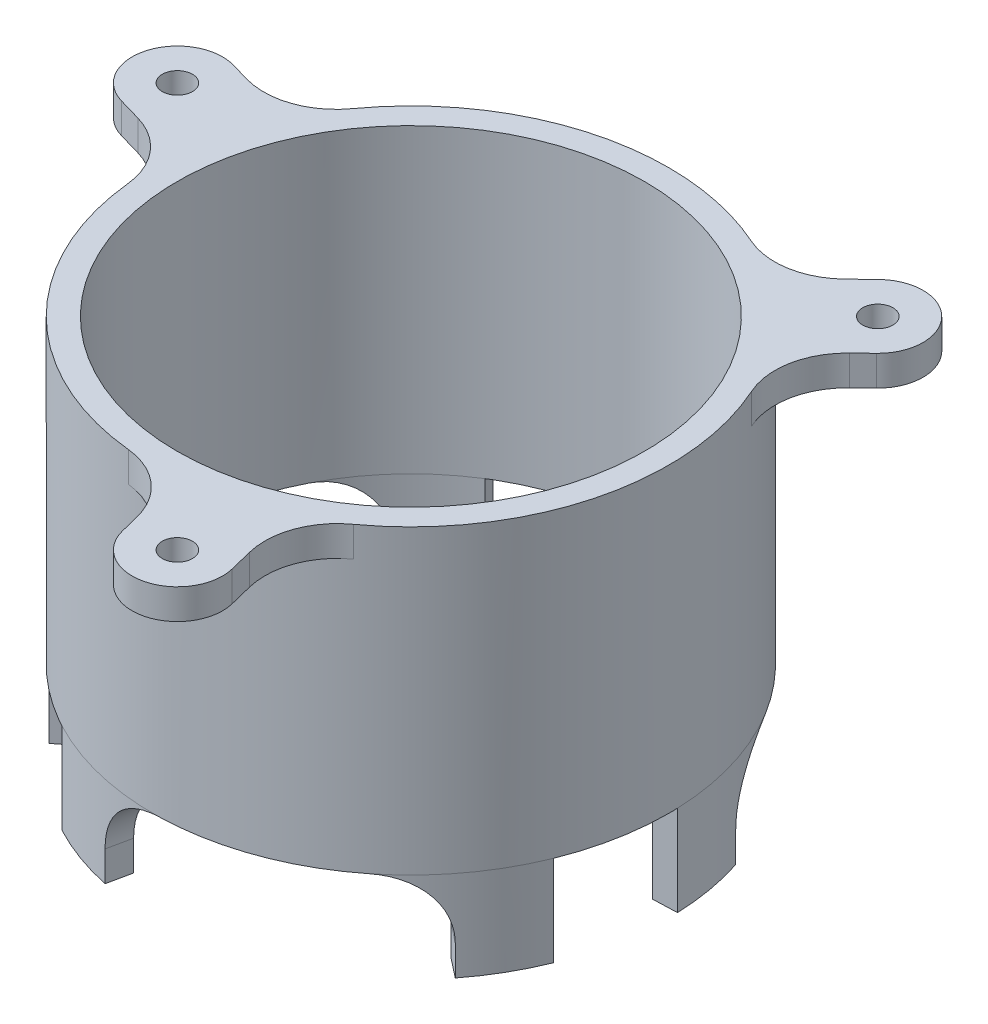
from build123d import *
from build123d.topology import SkipClean

# Parameters (mm, degrees)
SKETCH1_R           = 42.74999999999999
SKETCH1_R_2         = 38.75
BOSS_EXTRUDE1_DEPTH = 50
BOSS_EXTRUDE3_DEPTH = 15
FILLET11_R          = 10
BOSS_EXTRUDE4_START = -5
SKETCH3_R           = 2.5000000000000027
SKETCH3_R_2         = 2.499999999995902
SKETCH3_R_3         = 2.499999999998028
BOSS_EXTRUDE4_DEPTH = 5
FILLET12_R          = 12
CUT_EXTRUDE1_DEPTH  = 99.95736932696003


with BuildPart() as part:
    # Sketch1 → Boss-Extrude1 (new body)
    with BuildSketch(Plane(origin=(0, 0, 0), x_dir=(1, 0, 0), z_dir=(0, 1, 0))):
        with Locations(Location((0, 0, 0), (0, 0, 270))):
            Circle(SKETCH1_R)
        with Locations(Location((0, 0, 0), (0, 0, 270))):
            Circle(SKETCH1_R_2, mode=Mode.SUBTRACT)
    extrude(amount=BOSS_EXTRUDE1_DEPTH)

    # Sketch2 → Boss-Extrude3 (add)
    with BuildSketch(Plane.XZ):
        with BuildLine():
            Line((38.75, 0), (42.74999999999999, 0))
            ThreePointArc((42.74999999999999, 0), (42.22367645063639, -6.68757448683748), (40.657665385647135, -13.210478620729493))
            Line((40.657665385647135, -13.210478620729493), (36.853439320466514, -11.974410643229694))
            ThreePointArc((36.853439320466514, -11.974410643229694), (38.272923088255865, -6.061836626676557), (38.75, 0))
        make_face()
        with BuildLine():
            Line((30.53541703259137, 23.856881746065003), (33.68746022219302, 26.319527423154156))
            ThreePointArc((33.68746022219302, 26.319527423154156), (37.3899927357603, 20.7256109377942), (40.17185953859756, 14.621361127172362))
            Line((40.17185953859756, 14.621361127172362), (36.41308905545394, 13.253280553869686))
            ThreePointArc((36.41308905545394, 13.253280553869686), (33.891513838231084, 18.78637258123708), (30.53541703259137, 23.856881746065003))
        make_face()
        with BuildLine():
            Line((-7.423459595259061, -42.10053144127372), (-6.728866884591348, -38.161300429224895))
            ThreePointArc((-6.728866884591348, -38.161300429224895), (-0.6762810188026127, -38.74409824724033), (5.392957130880042, -38.3728877384105))
            Line((5.392957130880042, -38.3728877384105), (5.949649252958357, -42.333960052975826))
            ThreePointArc((5.949649252958357, -42.333960052975826), (-0.7460907867955708, -42.74348902538298), (-7.423459595259061, -42.10053144127372))
        make_face()
        with BuildLine():
            Line((-31.769442774524343, -28.605331772174747), (-28.796863472614763, -25.92880934673931))
            ThreePointArc((-28.796863472614763, -25.92880934673931), (-24.386166056418613, -30.114405358181113), (-19.374999999997826, -33.558484396648836))
            Line((-19.374999999997826, -33.558484396648836), (-21.374999999997822, -37.022586011786586))
            ThreePointArc((-21.374999999997822, -37.022586011786586), (-26.90344762061796, -33.22298920400898), (-31.769442774524343, -28.605331772174747))
        make_face()
        with BuildLine():
            Line((-32.748399943336835, 27.479170314096717), (-29.68422217086093, 24.908019875350572))
            ThreePointArc((-29.68422217086093, 24.908019875350572), (-33.21523281942682, 19.95772566599861), (-35.92837416346974, 14.516005992340855))
            Line((-35.92837416346974, 14.516005992340855), (-39.63710947514971, 16.01443262981703))
            ThreePointArc((-39.63710947514971, 16.01443262981703), (-36.64390194896306, 22.017878087584137), (-32.748399943336835, 27.479170314096717))
        make_face()
        with BuildLine():
            Line((-8.888222611121137, 41.8158103928996), (-8.056575847850104, 37.90321998996437))
            ThreePointArc((-8.056575847850104, 37.90321998996437), (-13.886757031835588, 36.17624198485303), (-19.37500000000052, 33.5584843966442))
            Line((-19.37500000000052, 33.5584843966442), (-21.37500000000052, 37.02258601178195))
            ThreePointArc((-21.37500000000052, 37.02258601178195), (-15.320228830016775, 39.91056369084182), (-8.888222611121137, 41.8158103928996))
        make_face()
    extrude(amount=BOSS_EXTRUDE3_DEPTH)

    # Fillet11
    # the kernel refuses this fillet: 10 mm, written as the material it adds along each edge
    with BuildSketch(Plane(origin=(10.835147097581084, 0, 8.465346264257812), x_dir=(-0.6156614192722877, 0, 0.7880107974004115), z_dir=(0.7880107974004116, 0, 0.6156614192722877))) as fillet11_piece_1_section:
        with BuildLine():
            CenterArc((FILLET11_R, FILLET11_R), FILLET11_R, 180, 90)
            Line((-2.49e-15, FILLET11_R), (0, 0))
            Line((0, 0), (FILLET11_R, 0))
        make_face()
    fillet11_piece_1 = extrude(amount=54, mode=Mode.PRIVATE)
    fillet11_piece_1 = fillet11_piece_1 & Plane(origin=(4.59061190483e-06, -2.230126202783113, 2.54461775206e-06), x_dir=(0.7880107536067299, 0, 0.6156614753256483), z_dir=(0, 1, 0)) * Cylinder(42.749994815925334, 148, mode=Mode.PRIVATE)
    fillet11_piece_1 = fillet11_piece_1 - Plane(origin=(4.59061572045e-06, -2.230126202783113, 2.54461984817e-06), x_dir=(0.9396926280330065, 0, 0.34202012341443), z_dir=(0, 1, 0)) * Cylinder(38.74999481592104, 148, mode=Mode.PRIVATE)
    add(fillet11_piece_1)
    with BuildSketch(Plane(origin=(64.43407829302596, 0, -20.935903480103214), x_dir=(-0.3090169943749489, 0, -0.9510565162951531), z_dir=(-0.9510565162951531, 0, 0.3090169943749489))) as fillet11_piece_2_section:
        with BuildLine():
            CenterArc((FILLET11_R, FILLET11_R), FILLET11_R, 180, 90)
            Line((0, FILLET11_R), (0, 0))
            Line((0, 0), (FILLET11_R, 0))
        make_face()
    fillet11_piece_2 = extrude(amount=54, mode=Mode.PRIVATE)
    fillet11_piece_2 = fillet11_piece_2 & Plane(origin=(5.18407557237e-06, -2.2301270287975066, -8.21077077e-07), x_dir=(0.9999999999999999, 0, 1.920648366230405e-08), z_dir=(0, 1, 0)) * Cylinder(42.749994815924424, 148, mode=Mode.PRIVATE)
    fillet11_piece_2 = fillet11_piece_2 - Plane(origin=(5.18407759387e-06, -2.2301270287975066, -8.2107737676e-07), x_dir=(0.951056492044892, 0, -0.3090170690095685), z_dir=(0, 1, 0)) * Cylinder(38.74999481592241, 148, mode=Mode.PRIVATE)
    add(fillet11_piece_2)
    with BuildSketch(Plane(origin=(1.9136313678905688, 0, -13.616185772377186), x_dir=(0.9902680786413326, 0, 0.13917303051957894), z_dir=(0.13917303051957894, 0, -0.9902680786413326))) as fillet11_piece_3_section:
        with BuildLine():
            CenterArc((FILLET11_R, FILLET11_R), FILLET11_R, 180, 90)
            Line((-1.7e-15, FILLET11_R), (0, 0))
            Line((0, 0), (FILLET11_R, 0))
        make_face()
    fillet11_piece_3 = extrude(amount=53.99999999999999, mode=Mode.PRIVATE)
    fillet11_piece_3 = fillet11_piece_3 & Plane(origin=(-9.160021364e-08, -2.2301268177813673, -5.24789779632e-06), x_dir=(0.13917310096005606, 0, -0.9902680687415717), z_dir=(0, 1, 0)) * Cylinder(42.74999481592479, 148, mode=Mode.PRIVATE)
    fillet11_piece_3 = fillet11_piece_3 - Plane(origin=(-9.160024539e-08, -2.2301268177813673, -5.24790106127e-06), x_dir=(-0.1736481985341157, 0, -0.98480774933276), z_dir=(0, 1, 0)) * Cylinder(38.74999481592157, 148, mode=Mode.PRIVATE)
    add(fillet11_piece_3)
    with BuildSketch(Plane(origin=(-50.348063411459194, 0, -45.333596931146204), x_dir=(-0.6691306063588583, 0, 0.7431448254773941), z_dir=(0.7431448254773941, 0, 0.6691306063588583))) as fillet11_piece_4_section:
        with BuildLine():
            CenterArc((FILLET11_R, FILLET11_R), FILLET11_R, 180, 90)
            Line((0, FILLET11_R), (0, 0))
            Line((0, 0), (FILLET11_R, 0))
        make_face()
    fillet11_piece_4 = extrude(amount=54, mode=Mode.PRIVATE)
    fillet11_piece_4 = fillet11_piece_4 & Plane(origin=(-3.30310971641e-06, -2.2301270903644643, -4.07900507859e-06), x_dir=(-0.4999999833666949, 0, -0.8660254133876817), z_dir=(0, 1, 0)) * Cylinder(42.74999481592363, 148, mode=Mode.PRIVATE)
    fillet11_piece_4 = fillet11_piece_4 - Plane(origin=(-3.30311013208e-06, -2.2301270903644643, -4.07900559019e-06), x_dir=(-0.7431448779877398, 0, -0.6691305480402069), z_dir=(0, 1, 0)) * Cylinder(38.74999481592298, 148, mode=Mode.PRIVATE)
    add(fillet11_piece_4)
    with BuildSketch(Plane(origin=(-12.748778465469993, 0, 5.150839508114776), x_dir=(-0.37460665936904325, 0, -0.92718382791999), z_dir=(-0.9271838279199901, 0, 0.37460665936904325))) as fillet11_piece_5_section:
        with BuildLine():
            CenterArc((FILLET11_R, FILLET11_R), FILLET11_R, 180, 90)
            Line((-7e-16, FILLET11_R), (0, 0))
            Line((0, 0), (FILLET11_R, 0))
        make_face()
    fillet11_piece_5 = extrude(amount=54.000000000000014, mode=Mode.PRIVATE)
    fillet11_piece_5 = fillet11_piece_5 & Plane(origin=(-4.49901083854e-06, -2.230126003773029, 2.70327532093e-06), x_dir=(-0.9271838545667841, 0, 0.37460659341592023), z_dir=(0, 1, 0)) * Cylinder(42.74999481592445, 149, mode=Mode.PRIVATE)
    fillet11_piece_5 = fillet11_piece_5 - Plane(origin=(-4.49901406974e-06, -2.230126003773029, 2.70327729979e-06), x_dir=(-0.7660444294988882, 0, 0.64278762591833), z_dir=(0, 1, 0)) * Cylinder(38.749994815920715, 149, mode=Mode.PRIVATE)
    add(fillet11_piece_5)
    with BuildSketch(Plane(origin=(-14.08601488156509, 0, 66.26950041124476), x_dir=(0.9781476007338059, 0, 0.20791169081775793), z_dir=(0.20791169081775795, 0, -0.9781476007338059))) as fillet11_piece_6_section:
        with BuildLine():
            CenterArc((FILLET11_R, FILLET11_R), FILLET11_R, 180, 90)
            Line((0, FILLET11_R), (0, 0))
            Line((0, 0), (FILLET11_R, 0))
        make_face()
    fillet11_piece_6 = extrude(amount=54.00000000000003, mode=Mode.PRIVATE)
    fillet11_piece_6 = fillet11_piece_6 & Plane(origin=(-1.88096511966e-06, -2.2301273000285007, 4.90007795761e-06), x_dir=(-0.5000000166333063, 0, 0.8660253941811946), z_dir=(0, 1, 0)) * Cylinder(42.74999481592328, 149, mode=Mode.PRIVATE)
    fillet11_piece_6 = fillet11_piece_6 - Plane(origin=(-1.88096534792e-06, -2.2301273000285007, 4.90007855092e-06), x_dir=(-0.20791161405715206, 0, 0.9781476170497733), z_dir=(0, 1, 0)) * Cylinder(38.74999481592266, 149, mode=Mode.PRIVATE)
    add(fillet11_piece_6)

    # Sketch3 → Boss-Extrude4 (add)
    # profile 1 of 3: a face of its own
    with SkipClean():  # the faces are left unmerged after this step: merging them gives an invalid solid
        with BuildSketch(Plane(origin=(0, 50, 0), x_dir=(1, 0, 0), z_dir=(0, 1, 0)).offset(BOSS_EXTRUDE4_START)):
            with BuildLine():
                Line((33.511637227041675, 44.116356899248466), (21.30894025148576, 32.364974360543066))
                ThreePointArc((21.30894025148576, 32.364974360543066), (27.172199137767333, 27.626691695125434), (32.007081006023014, 21.842830985792126))
                Line((32.007081006023014, 21.842830985792126), (43.91655531288513, 33.311835640678616))
                ThreePointArc((43.91655531288513, 33.311835640678616), (44.11635689924832, 43.91655531288527), (33.511637227041675, 44.116356899248466))
            make_face()
            with Locations(Location((38.7140962699634, 38.71409626996354, 0), (0, 0, 270))):
                Circle(SKETCH3_R, mode=Mode.SUBTRACT)
        # profile 2 of 3: a face of its own
        with BuildSketch(Plane(origin=(0, 50, 0), x_dir=(1, 0, 0), z_dir=(0, 1, 0)).offset(BOSS_EXTRUDE4_START)):
            with BuildLine():
                Line((21.450067183648166, -51.08010761065472), (17.374419863318376, -34.636570765787056))
                ThreePointArc((17.374419863318376, -34.636570765787056), (10.33931726161448, -37.345160577562936), (2.912906021253314, -38.64036074510248))
                Line((2.912906021253314, -38.64036074510248), (6.890618255075937, -54.68877036800639))
                ThreePointArc((6.890618255075937, -54.68877036800639), (15.97467409803788, -60.16416345361666), (21.450067183648166, -51.08010761065472))
            make_face()
            with Locations(Location((14.170342719362047, -52.88443898933055, 0), (0, 0, 270))):
                Circle(SKETCH3_R_2, mode=Mode.SUBTRACT)
        # profile 3 of 3: a face of its own
        with BuildSketch(Plane(origin=(0, 50, 0), x_dir=(1, 0, 0), z_dir=(0, 1, 0)).offset(BOSS_EXTRUDE4_START)):
            with BuildLine():
                Line((-54.96170441069497, 6.963750711401009), (-38.68336011480927, 2.2715964052387614))
                ThreePointArc((-38.68336011480927, 2.2715964052387614), (-37.51151639938695, 9.718468882432287), (-34.919987027281465, 16.797529759305117))
                Line((-34.919987027281465, 16.797529759305117), (-50.8071735679662, 21.37693472732252))
                ThreePointArc((-50.8071735679662, 21.37693472732252), (-60.09103099729134, 16.247608140726154), (-54.96170441069497, 6.963750711401009))
            make_face()
            with Locations(Location((-52.88443898933059, 14.170342719361772, 0), (0, 0, 270))):
                Circle(SKETCH3_R_3, mode=Mode.SUBTRACT)
        extrude(amount=BOSS_EXTRUDE4_DEPTH)

    # Fillet12
    # the kernel refuses this fillet: 12 mm, written as the material it adds along each edge
    with BuildSketch(Plane(origin=(34.92538168322465, 50, -24.653198865077854), x_dir=(0.4956414180531426, 0, 0.868527250413175), z_dir=(0, -1, 0))) as fillet12_piece_1:
        with BuildLine():
            CenterArc((9.354319503247144, -11.944643415577572), FILLET12_R, 95.50552505302721, 70.28590162466685)
            Line((-2.2785840931773462, -8.999214089266344), (0, 0))
            ThreePointArc((0, 0), (4.101509320654527, -0.1972078320049116), (8.203018641309042, -2.9e-16))
        make_face()
    extrude(amount=5)
    with BuildSketch(Plane(origin=(24.255614002642524, 50, -35.202665941016626), x_dir=(-0.871971609840304, 0, -0.48955644376568963), z_dir=(0, -1, 0))) as fillet12_piece_2:
        with BuildLine():
            CenterArc((8.932402267564173, 11.949534715437375), FILLET12_R, 196.7679395306473, 67.9755723410264)
            Line((-2.5573706744403597, 8.487581835749301), (0, 0))
            ThreePointArc((0, 0), (3.916514840393532, 0.17978257625434443), (7.833029680787052, 1.1e-16))
        make_face()
    extrude(amount=5)
    with BuildSketch(Plane(origin=(3.887605660092766, 50, 42.57286720707937), x_dir=(-0.9999873717634292, 0, -0.005025566004865019), z_dir=(0, -1, 0))) as fillet12_piece_3:
        with BuildLine():
            CenterArc((9.354319503246753, -11.944643415577572), FILLET12_R, 95.50552505302706, 70.28590162466459)
            Line((-2.2785840931776087, -8.999214089265854), (0, 0))
            ThreePointArc((0, 0), (4.101509320654338, -0.197207832004895), (8.203018641308686, 0))
        make_face()
    extrude(amount=5)
    with BuildSketch(Plane(origin=(18.358595984534514, 50, 38.60731088118716), x_dir=(0.8599541218076301, 0, -0.5103713436176327), z_dir=(0, -1, 0))) as fillet12_piece_4:
        with BuildLine():
            CenterArc((8.932402267564584, 11.949534715437368), FILLET12_R, 196.7679395306447, 67.97557234102874)
            Line((-2.5573706744401097, 8.487581835749824), (0, 0))
            ThreePointArc((0, 0), (3.9165148403936985, 0.17978257625437336), (7.833029680787395, 4.4e-16))
        make_face()
    extrude(amount=5)
    with BuildSketch(Plane(origin=(-38.81298734332038, 50, -17.91966834199929), x_dir=(0.5043459537102459, 0, -0.8635016844083758), z_dir=(0, -1, 0))) as fillet12_piece_5:
        with BuildLine():
            CenterArc((9.354319503247599, -11.944643415577568), FILLET12_R, 95.50552505302745, 70.28590162466934)
            Line((-2.2785840931770296, -8.999214089266896), (0, 0))
            ThreePointArc((0, 0), (4.101509320654717, -0.19720783200493475), (8.203018641309445, 4e-17))
        make_face()
    extrude(amount=5)
    with BuildSketch(Plane(origin=(-42.61420998717906, 50, -3.404644940167401), x_dir=(0.012017488032744224, 0, 0.9999277873833604), z_dir=(0, -1, 0))) as fillet12_piece_6:
        with BuildLine():
            CenterArc((8.932402267563731, 11.949534715437377), FILLET12_R, 196.76793953064976, 67.97557234102419)
            Line((-2.5573706744406537, 8.487581835748815), (0, 0))
            ThreePointArc((0, 0), (3.916514840393324, 0.17978257625433922), (7.8330296807866535, 0))
        make_face()
    extrude(amount=5)

    # Sketch4 → Cut-Extrude1 (cut, through all)
    with SkipClean():  # the faces are left unmerged after this step: merging them gives an invalid solid
        with BuildSketch(Plane(origin=(0, 0, 0), x_dir=(1, 0, 0), z_dir=(0, 1, 0))):
            with BuildLine():
                Line((-20.534371333159484, 32.86186347661107), (-22.654047056796177, 36.2540537275175))
                ThreePointArc((-22.654047056796177, 36.2540537275175), (-15.123777980482348, 41.552238290206105), (-5.94965002510261, 42.333959647417295))
                Line((-5.94965002510261, 42.333959647417295), (-5.392957621262538, 38.37288737245051))
                ThreePointArc((-5.392957621262538, 38.37288737245051), (-13.25328045326254, 36.41308877904585), (-20.534371333159484, 32.86186347661107))
            make_face()
            with BuildLine():
                Line((38.72639425302094, 1.3523554869533245), (42.72395504659418, 1.4919533859546337))
                ThreePointArc((42.72395504659418, 1.4919533859546337), (43.547182933664175, -7.678543212809822), (39.63710950999994, -16.014431758343253))
                Line((39.63710950999994, -16.014431758343253), (35.92837409173245, -14.51600538467917))
                ThreePointArc((35.92837409173245, -14.51600538467917), (38.16130013954304, -6.728866833518007), (38.72639425302094, 1.3523554869533245))
            make_face()
            with BuildLine():
                Line((-18.192022919861778, -34.2142189635644), (-20.069907989798345, -37.746007113472146))
                ThreePointArc((-20.069907989798345, -37.746007113472146), (-28.423404953182153, -33.873695077396334), (-33.68745948489764, -26.31952788907392))
                Line((-33.68745948489764, -26.31952788907392), (-30.535416470470206, -23.856881987771228))
                ThreePointArc((-30.535416470470206, -23.856881987771228), (-24.908019686280806, -29.6842219455278), (-18.192022919861778, -34.2142189635644))
            make_face()
        extrude(amount=-CUT_EXTRUDE1_DEPTH, mode=Mode.SUBTRACT)


solid = part.part
